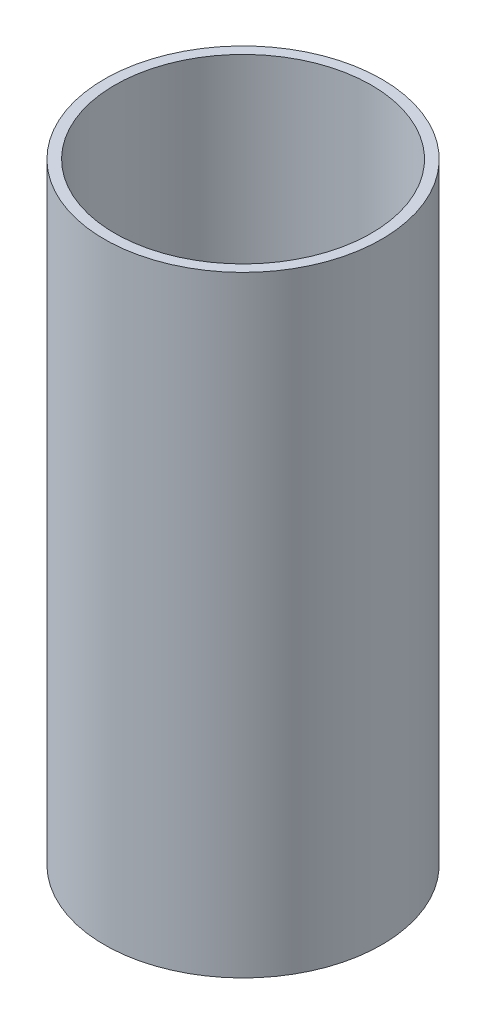
from build123d import *

# Parameters (mm, degrees)
SKETCH1_R      = 109.5375
SKETCH1_R_2    = 101.3587
EXTRUDE1_DEPTH = 482.6


with BuildPart() as part:
    # Sketch1 → Extrude1 (new body)
    with BuildSketch(Plane(origin=(0, 0, 0), x_dir=(1, 0, 0), z_dir=(0, 1, 0))):
        Circle(SKETCH1_R)
        Circle(SKETCH1_R_2, mode=Mode.SUBTRACT)
    extrude(amount=EXTRUDE1_DEPTH)


solid = part.part
